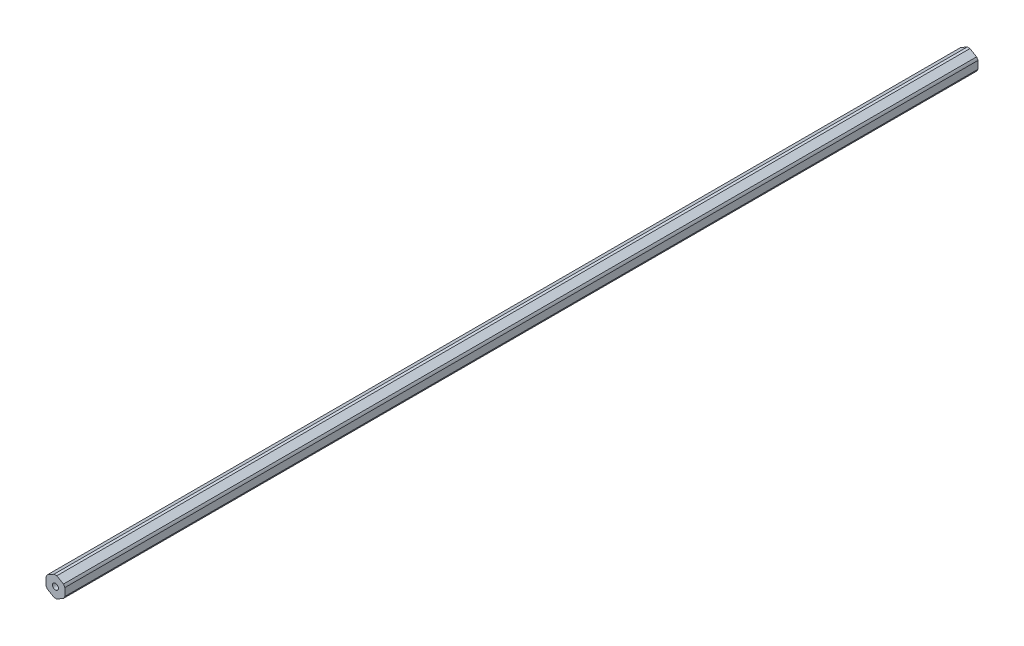
from build123d import *

# Parameters (mm, degrees)
SKETCH2_R                            = 2.0193
BOSS_EXTRUDE1_DEPTH                  = 307.975
F_10_32_TAPPED_HOLE2_D               = 4.0386
F_10_32_TAPPED_HOLE2_DEPTH           = 16.34744
F_10_32_TAPPED_HOLE2_TIP             = 1.213317848
F_10_32_TAPPED_HOLE2_ON_FACE_2_D     = 4.0386
F_10_32_TAPPED_HOLE2_ON_FACE_2_DEPTH = 16.34744
F_10_32_TAPPED_HOLE2_ON_FACE_2_TIP   = 1.213317848


with BuildPart() as part:
    # Sketch2 → Boss-Extrude1 (new, symmetric)
    with BuildSketch(Plane.XY):
        with BuildLine():
            ThreePointArc((0.93173274, 6.79441227), (0, 6.858), (-0.93173274, 6.79441227))
            Line((-0.93173274, 6.79441227), (-5.41826726, 4.204110358))
            ThreePointArc((-5.41826726, 4.204110358), (-5.939202219, 3.429), (-6.35, 2.590301913))
            Line((-6.35, 2.590301913), (-6.35, -2.590301913))
            ThreePointArc((-6.35, -2.590301913), (-5.939202219, -3.429), (-5.41826726, -4.204110358))
            Line((-5.41826726, -4.204110358), (-0.93173274, -6.79441227))
            ThreePointArc((-0.93173274, -6.79441227), (0, -6.858), (0.93173274, -6.79441227))
            Line((0.93173274, -6.79441227), (5.41826726, -4.204110358))
            ThreePointArc((5.41826726, -4.204110358), (5.939202219, -3.429), (6.35, -2.590301913))
            Line((6.35, -2.590301913), (6.35, 2.590301913))
            ThreePointArc((6.35, 2.590301913), (5.939202219, 3.429), (5.41826726, 4.204110358))
            Line((5.41826726, 4.204110358), (0.93173274, 6.79441227))
        make_face()
        Circle(SKETCH2_R, mode=Mode.SUBTRACT)
    extrude(amount=BOSS_EXTRUDE1_DEPTH, both=True)

    # #10-32 Tapped Hole2
    with Locations(Plane(origin=(0, 0, -307.975), x_dir=(-1, 0, 0), z_dir=(0, 0, -1))):
        with Locations((0, 0)):
            Hole(F_10_32_TAPPED_HOLE2_D / 2, depth=F_10_32_TAPPED_HOLE2_DEPTH)
            with Locations((0, 0, -(F_10_32_TAPPED_HOLE2_DEPTH + F_10_32_TAPPED_HOLE2_TIP / 2))):  # 118° drill point
                Cone(0, F_10_32_TAPPED_HOLE2_D / 2, F_10_32_TAPPED_HOLE2_TIP, mode=Mode.SUBTRACT)

    # #10-32 Tapped Hole2 on face 2
    with Locations(Plane(origin=(0, 0, 307.975), x_dir=(-1, 0, 0), z_dir=(0, 0, -1))):
        with Locations((0, 0)):
            Hole(F_10_32_TAPPED_HOLE2_ON_FACE_2_D / 2, depth=F_10_32_TAPPED_HOLE2_ON_FACE_2_DEPTH)
            with Locations((0, 0, -(F_10_32_TAPPED_HOLE2_ON_FACE_2_DEPTH + F_10_32_TAPPED_HOLE2_ON_FACE_2_TIP / 2))):  # 118° drill point
                Cone(0, F_10_32_TAPPED_HOLE2_ON_FACE_2_D / 2, F_10_32_TAPPED_HOLE2_ON_FACE_2_TIP, mode=Mode.SUBTRACT)


solid = part.part
